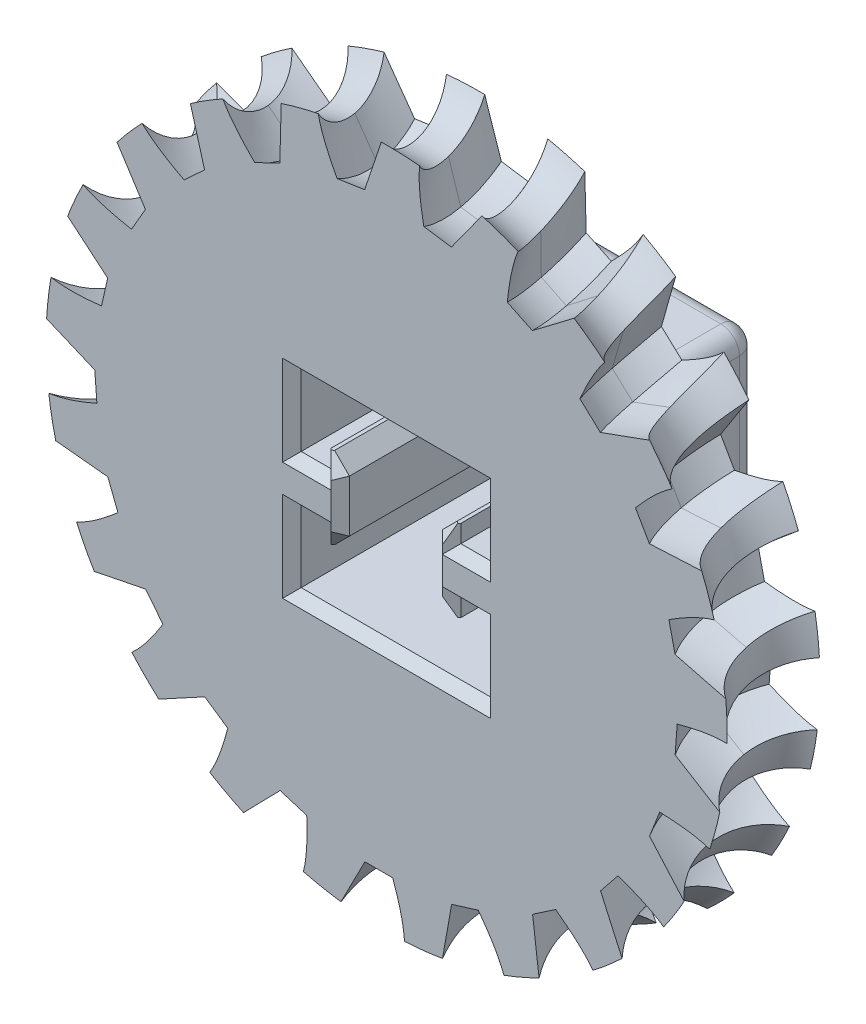
from build123d import *

# Parameters (mm, degrees)
SKETCH1_R              = 40
SKETCH1_R_2            = 4
BOSS_EXTRUDE1_DEPTH    = 10
CHAMFER1_SIZE          = 2
SKETCH2_R              = 6
CUT_SWEEP1_PITCH       = 10
CUT_SWEEP1_HEIGHT      = 2.5
CUT_SWEEP1_RADIUS      = 6
CUT_SWEEP1_START_ANGLE = -90
CUT_SWEEP2_PITCH       = 10
CUT_SWEEP2_HEIGHT      = 2.5
CUT_SWEEP2_RADIUS      = 6
CUT_SWEEP2_START_ANGLE = -90
CIRPATTERN1_COUNT      = 21
SKETCH14_W             = 30
SKETCH14_H             = 30
BOSS_EXTRUDE2_DEPTH    = 15
CUT_EXTRUDE4_DEPTH     = 25
CUT_EXTRUDE3_REACH     = 67.089
SKETCH15_R             = 2
FILLET1_R              = 2
CHAMFER2_SIZE          = 1


with BuildPart() as part:
    # Sketch1 → Boss-Extrude1 (new body)
    with BuildSketch(Plane.XY):
        Circle(SKETCH1_R)
        Circle(SKETCH1_R_2, mode=Mode.SUBTRACT)
    extrude(amount=BOSS_EXTRUDE1_DEPTH)

    # Chamfer1
    chamfer1_edges = [part.edges().sort_by_distance(p)[0] for p in [
        (-40, 0, 0),
        (-40, 0, 10),
    ]]
    chamfer(chamfer1_edges, length=CHAMFER1_SIZE)

    # Sketch2 → Cut-Revolve1 (revolve, cut)
    with BuildSketch(Plane(origin=(0, 0, 0), x_dir=(0, 0, -1), z_dir=(1, 0, 0)), mode=Mode.PRIVATE) as cut_revolve1_sk:
        with Locations((-5, -40)):
            Circle(SKETCH2_R)
    revolve(cut_revolve1_sk.sketch.rotate(Axis((0, 0, 0), (0, 0, -1)), 90), axis=Axis((0, 0, 0), (0, 0, -1)), mode=Mode.SUBTRACT)

    # Cut-Sweep1: sweep along a helix
    with BuildLine() as cut_sweep1_path:
        add(Helix(CUT_SWEEP1_PITCH, CUT_SWEEP1_HEIGHT, CUT_SWEEP1_RADIUS, center=(0, -40, 5), direction=(1, 0, 0), lefthand=True, mode=Mode.PRIVATE).rotate(Axis((0, -40, 5), (1, 0, 0)), CUT_SWEEP1_START_ANGLE))
    # Sketch5 → Cut-Sweep1 (sweep, cut)
    with BuildSketch(Plane.XY.offset(5)):
        Polygon((-1.5, -30), (1.5, -30), (3.5, -34), (3.5, -35.519818185), (-3.5, -35.519818185), (-3.5, -34), align=None)
    cut_sweep1 = sweep(path=cut_sweep1_path.line, is_frenet=True, mode=Mode.SUBTRACT)

    # Cut-Sweep2: sweep along a helix
    with BuildLine() as cut_sweep2_path:
        add(Helix(CUT_SWEEP2_PITCH, CUT_SWEEP2_HEIGHT, CUT_SWEEP2_RADIUS, center=(0, -40, 5), direction=(-1, 0, 0), lefthand=True, mode=Mode.PRIVATE).rotate(Axis((0, -40, 5), (-1, 0, 0)), CUT_SWEEP2_START_ANGLE))
    # Sketch7 → Cut-Sweep2 (sweep, cut)
    with BuildSketch(Plane.XY.offset(5)):
        Polygon((1.5, -30), (-1.5, -30), (-3.5, -34), (-3.5, -35.519818185), (3.5, -35.519818185), (3.5, -34), align=None)
    cut_sweep2 = sweep(path=cut_sweep2_path.line, is_frenet=True, mode=Mode.SUBTRACT)

    # CirPattern1: Cut-Sweep1, Cut-Sweep2 ×21 about axis
    cirpattern1_axis = Axis((0, 0, 10), (0, 0, -1))
    add([cut_sweep1.rotate(cirpattern1_axis, i * 360 / CIRPATTERN1_COUNT) for i in range(1, CIRPATTERN1_COUNT)], mode=Mode.SUBTRACT)
    add([cut_sweep2.rotate(cirpattern1_axis, i * 360 / CIRPATTERN1_COUNT) for i in range(1, CIRPATTERN1_COUNT)], mode=Mode.SUBTRACT)

    # Sketch14 → Boss-Extrude2 (add)
    with BuildSketch(Plane(origin=(0, 0, 0), x_dir=(-1, 0, 0), z_dir=(0, 0, -1))):
        Rectangle(SKETCH14_W, SKETCH14_H)
    extrude(amount=BOSS_EXTRUDE2_DEPTH)

    # Sketch13 → Cut-Extrude4 (cut)
    with BuildSketch(Plane.XY.offset(10)):
        Polygon((-3.1, 10.2), (3.1, 10.2), (10.2, 10.2), (10.2, 2.5), (7, 2.5), (7, 4.4), (6.6, 4.4), (5, 2.8), (5, -2.8), (6.6, -4.4), (7, -4.4), (7, -2.5), (10.2, -2.5), (10.2, -10.2), (3.1, -10.2), (-3.1, -10.2), (-10.2, -10.2), (-10.2, -2.5), (-7, -2.5), (-7, -4.4), (-6.6, -4.4), (-5, -2.8), (-5, 2.8), (-6.6, 4.4), (-7, 4.4), (-7, 2.5), (-10.2, 2.5), (-10.2, 10.2), align=None)
    extrude(amount=-CUT_EXTRUDE4_DEPTH, mode=Mode.SUBTRACT)

    # Cut-Extrude3: up to this face of the body (flat: up to its plane)
    cut_extrude3_end = Plane(part.part.faces().sort_by_distance((0, -15, -7.5))[0])
    # Sketch15 → Cut-Extrude3 (cut, up to the picked face)
    with BuildSketch(Plane(origin=(0, 15, 0), x_dir=(1, 0, 0), z_dir=(0, 1, 0)), mode=Mode.PRIVATE) as cut_extrude3_sk1:
        with Locations(Location((0, 7.5, 0), (0, 0, 270))):
            Circle(SKETCH15_R)
    cut_extrude3_tool1 = split(extrude(cut_extrude3_sk1.sketch, amount=-CUT_EXTRUDE3_REACH, mode=Mode.PRIVATE), bisect_by=cut_extrude3_end, keep=Keep.BOTH, mode=Mode.PRIVATE)
    add(cut_extrude3_tool1.solids().sort_by(Axis((0, 15, -7.5), (0, -1, 0)))[0], mode=Mode.SUBTRACT)

    # Fillet1
    fillet1_edges = [part.edges().sort_by_distance(p)[0] for p in [
        (0, -15, -9.5),
        (15, 0, -15),
        (15, 15, -7.5),
        (0, -15, 0),
        (15, -15, -7.5),
        (-15, 0, 0),
        (-15, -15, -7.5),
        (0, 15, -15),
        (-15, 15, -7.5),
        (0, -15, -15),
        (-15, 0, -15),
        (15, 0, 0),
        (0, 15, 0),
    ]]
    fillet(fillet1_edges, radius=FILLET1_R)

    # Chamfer2
    # the kernel refuses this chamfer: 1 mm, written as the material it takes off along each edge
    with BuildSketch(Plane(origin=(-10.2, 2.5, 10), x_dir=(-1, 0, 0), z_dir=(0, 1, 0)), Plane(origin=(-10.2, -10.2, 10), x_dir=(-1, 0, 0), z_dir=(0, 1, 0)), Plane(origin=(10.2, -2.5, 10), x_dir=(1, 0, 0), z_dir=(0, -1, 0)), Plane(origin=(10.2, 10.2, 10), x_dir=(1, 0, 0), z_dir=(0, -1, 0)), Plane(origin=(10.2, 10.2, -15), x_dir=(0, 0, 1), z_dir=(0, -1, 0)), Plane(origin=(10.2, -2.5, -15), x_dir=(0, 0, 1), z_dir=(0, -1, 0)), Plane(origin=(-10.2, -10.2, -15), x_dir=(0, 0, 1), z_dir=(0, 1, 0)), Plane(origin=(-10.2, 2.5, -15), x_dir=(0, 0, 1), z_dir=(0, 1, 0))) as chamfer2_piece_1:
        Polygon((CHAMFER2_SIZE, 0), (0, -CHAMFER2_SIZE), (0, 0), align=None)
    chamfer2_piece_1_solid = extrude(amount=7.7, mode=Mode.PRIVATE)
    with BuildSketch(Plane(origin=(-7, 2.5, 10), x_dir=(0, -1, 0), z_dir=(-1, 0, 0)), Plane(origin=(-10.2, -2.5, 10), x_dir=(0, 1, 0), z_dir=(1, 0, 0)), Plane(origin=(7, -2.5, 10), x_dir=(0, 1, 0), z_dir=(1, 0, 0)), Plane(origin=(10.2, 2.5, 10), x_dir=(0, -1, 0), z_dir=(-1, 0, 0)), Plane(origin=(10.2, 2.5, -15), x_dir=(0, 0, 1), z_dir=(-1, 0, 0)), Plane(origin=(7, -2.5, -15), x_dir=(0, 0, 1), z_dir=(1, 0, 0)), Plane(origin=(-10.2, -2.5, -15), x_dir=(0, 0, 1), z_dir=(1, 0, 0)), Plane(origin=(-7, 2.5, -15), x_dir=(0, 0, 1), z_dir=(-1, 0, 0))) as chamfer2_piece_2:
        Polygon((CHAMFER2_SIZE, 0), (0, -CHAMFER2_SIZE), (0, 0), align=None)
    chamfer2_piece_2_solid = extrude(amount=3.2, mode=Mode.PRIVATE)
    with BuildSketch(Plane(origin=(-7, 6.971682988, 10), x_dir=(1, 0, 0), z_dir=(0, -1, 0)), Plane(origin=(-7, -2.5, 10), x_dir=(1, 0, 0), z_dir=(0, -1, 0)), Plane(origin=(7, -6.971682988, 10), x_dir=(-1, 0, 0), z_dir=(0, 1, 0)), Plane(origin=(7, 2.5, 10), x_dir=(-1, 0, 0), z_dir=(0, 1, 0)), Plane(origin=(7, 2.5, -15), x_dir=(0, 0, 1), z_dir=(0, 1, 0)), Plane(origin=(7, -6.971682988, -15), x_dir=(0, 0, 1), z_dir=(0, 1, 0)), Plane(origin=(-7, -2.5, -15), x_dir=(0, 0, 1), z_dir=(0, -1, 0)), Plane(origin=(-7, 6.971682988, -15), x_dir=(0, 0, 1), z_dir=(0, -1, 0))) as chamfer2_piece_3:
        Polygon((CHAMFER2_SIZE, 0), (0, -CHAMFER2_SIZE), (0, 0), align=None)
    chamfer2_piece_3_solid = extrude(amount=4.471682988, mode=Mode.PRIVATE)
    with BuildSketch(Plane(origin=(-3.18154552, 0.98154552, 10), x_dir=(-0.7071067811865478, -0.7071067811865474, 0), z_dir=(-0.7071067811865474, 0.7071067811865478, 0)), Plane(origin=(-8.41845448, -6.21845448, 10), x_dir=(-0.7071067811865478, 0.7071067811865474, 0), z_dir=(0.7071067811865474, 0.7071067811865478, 0)), Plane(origin=(3.18154552, -0.98154552, 10), x_dir=(0.7071067811865478, 0.7071067811865474, 0), z_dir=(0.7071067811865474, -0.7071067811865478, 0)), Plane(origin=(8.41845448, 6.21845448, 10), x_dir=(0.7071067811865478, -0.7071067811865474, 0), z_dir=(-0.7071067811865474, -0.7071067811865478, 0)), Plane(origin=(8.41845448, 6.21845448, -15), x_dir=(0, 0, 1), z_dir=(-0.7071067811865474, -0.7071067811865478, 0)), Plane(origin=(3.18154552, -0.98154552, -15), x_dir=(0, 0, 1), z_dir=(0.7071067811865474, -0.7071067811865478, 0)), Plane(origin=(-8.41845448, -6.21845448, -15), x_dir=(0, 0, 1), z_dir=(0.7071067811865474, 0.7071067811865478, 0)), Plane(origin=(-3.18154552, 0.98154552, -15), x_dir=(0, 0, 1), z_dir=(-0.7071067811865474, 0.7071067811865478, 0))) as chamfer2_piece_4:
        Polygon((CHAMFER2_SIZE, 0), (0, -CHAMFER2_SIZE), (0, 0), align=None)
    chamfer2_piece_4_solid = extrude(amount=7.406107676, mode=Mode.PRIVATE)
    with BuildSketch(Plane(origin=(-5, -5.371682988, 10), x_dir=(-1, 0, 0), z_dir=(0, 1, 0)), Plane(origin=(5, 5.371682988, 10), x_dir=(1, 0, 0), z_dir=(0, -1, 0)), Plane(origin=(5, 5.371682988, -15), x_dir=(0, 0, 1), z_dir=(0, -1, 0)), Plane(origin=(-5, -5.371682988, -15), x_dir=(0, 0, 1), z_dir=(0, 1, 0))) as chamfer2_piece_5:
        Polygon((CHAMFER2_SIZE, 0), (0, -CHAMFER2_SIZE), (0, 0), align=None)
    chamfer2_piece_5_solid = extrude(amount=10.743365976, mode=Mode.PRIVATE)
    with BuildSketch(Plane(origin=(10.2, -10.2, 10), x_dir=(0, -1, 0), z_dir=(-1, 0, 0)), Plane(origin=(-10.2, 10.2, 10), x_dir=(0, 1, 0), z_dir=(1, 0, 0))) as chamfer2_piece_6:
        Polygon((CHAMFER2_SIZE, 0), (0, -CHAMFER2_SIZE), (0, 0), align=None)
    chamfer2_piece_6_solid = extrude(amount=20.4, mode=Mode.PRIVATE)
    with BuildSketch(Plane(origin=(-10.2, -10.2, -15), x_dir=(0, 0, 1), z_dir=(1, 0, 0)), Plane(origin=(10.2, 10.2, -15), x_dir=(0, 0, 1), z_dir=(-1, 0, 0))) as chamfer2_piece_7:
        Polygon((CHAMFER2_SIZE, 0), (0, CHAMFER2_SIZE), (0, 0), align=None)
    chamfer2_piece_7_solid = extrude(amount=20.4, mode=Mode.PRIVATE)
    with BuildSketch(Plane(origin=(0, 15, -7.5), x_dir=(0, 0, 1), z_dir=(-1, 0, 0))) as chamfer2_piece_8:
        Polygon((2 + CHAMFER2_SIZE, 0), (2, -CHAMFER2_SIZE), (2, 0), align=None)
    chamfer2_piece_8_solid = revolve(axis=Axis((0, 15, -7.5), (0, 1, 0)), mode=Mode.PRIVATE)
    with BuildSketch(Plane(origin=(-10.2, -0.071682988, 10), x_dir=(-1, 0, 0), z_dir=(0, 1, 0))) as chamfer2_piece_9a_section:
        Polygon((CHAMFER2_SIZE, 0), (0, -CHAMFER2_SIZE), (0, 0), align=None)
    chamfer2_piece_9a = extrude(amount=10.271682988, mode=Mode.PRIVATE)
    chamfer2_piece_9a = split(chamfer2_piece_9a, bisect_by=Plane(origin=(-10.2, 2.5, 10), z_dir=(0, -1, 0)), keep=Keep.TOP, mode=Mode.PRIVATE)
    with BuildSketch(Plane(origin=(-7, 2.5, 10), x_dir=(0, -1, 0), z_dir=(-1, 0, 0))) as chamfer2_piece_9b_section:
        Polygon((CHAMFER2_SIZE, 0), (0, -CHAMFER2_SIZE), (0, 0), align=None)
    chamfer2_piece_9b = extrude(amount=5.771682988, mode=Mode.PRIVATE)
    chamfer2_piece_9b = split(chamfer2_piece_9b, bisect_by=Plane(origin=(-10.2, 2.5, 10), z_dir=(-1, 0, 0)), keep=Keep.TOP, mode=Mode.PRIVATE)
    chamfer2_piece_9 = chamfer2_piece_9a & chamfer2_piece_9b
    with BuildSketch(Plane(origin=(-10.2, 2.5, 10), x_dir=(-1, 0, 0), z_dir=(0, 1, 0))) as chamfer2_piece_10a_section:
        Polygon((CHAMFER2_SIZE, 0), (0, -CHAMFER2_SIZE), (0, 0), align=None)
    chamfer2_piece_10a = extrude(amount=10.271682988, mode=Mode.PRIVATE)
    chamfer2_piece_10a = split(chamfer2_piece_10a, bisect_by=Plane(origin=(-10.2, 10.2, 10), z_dir=(0, 1, 0)), keep=Keep.TOP, mode=Mode.PRIVATE)
    with BuildSketch(Plane(origin=(-12.771682988, 10.2, 10), x_dir=(0, 1, 0), z_dir=(1, 0, 0))) as chamfer2_piece_10b_section:
        Polygon((CHAMFER2_SIZE, 0), (0, -CHAMFER2_SIZE), (0, 0), align=None)
    chamfer2_piece_10b = extrude(amount=22.971682988, mode=Mode.PRIVATE)
    chamfer2_piece_10b = split(chamfer2_piece_10b, bisect_by=Plane(origin=(-10.2, 10.2, 10), z_dir=(-1, 0, 0)), keep=Keep.TOP, mode=Mode.PRIVATE)
    chamfer2_piece_10 = chamfer2_piece_10a & chamfer2_piece_10b
    with BuildSketch(Plane(origin=(-4.428317012, 2.5, 10), x_dir=(0, -1, 0), z_dir=(-1, 0, 0))) as chamfer2_piece_11a_section:
        Polygon((CHAMFER2_SIZE, 0), (0, -CHAMFER2_SIZE), (0, 0), align=None)
    chamfer2_piece_11a = extrude(amount=5.771682988, mode=Mode.PRIVATE)
    chamfer2_piece_11a = split(chamfer2_piece_11a, bisect_by=Plane(origin=(-7, 2.5, 10), z_dir=(1, 0, 0)), keep=Keep.TOP, mode=Mode.PRIVATE)
    with BuildSketch(Plane(origin=(-7, 6.971682988, 10), x_dir=(1, 0, 0), z_dir=(0, -1, 0))) as chamfer2_piece_11b_section:
        Polygon((CHAMFER2_SIZE, 0), (0, -CHAMFER2_SIZE), (0, 0), align=None)
    chamfer2_piece_11b = extrude(amount=7.043365976, mode=Mode.PRIVATE)
    chamfer2_piece_11b = split(chamfer2_piece_11b, bisect_by=Plane(origin=(-7, 2.5, 10), z_dir=(0, -1, 0)), keep=Keep.TOP, mode=Mode.PRIVATE)
    chamfer2_piece_11 = chamfer2_piece_11a & chamfer2_piece_11b
    with BuildSketch(Plane(origin=(-7, 0.071682988, 10), x_dir=(1, 0, 0), z_dir=(0, -1, 0))) as chamfer2_piece_12a_section:
        Polygon((CHAMFER2_SIZE, 0), (0, -CHAMFER2_SIZE), (0, 0), align=None)
    chamfer2_piece_12a = extrude(amount=7.043365976, mode=Mode.PRIVATE)
    chamfer2_piece_12a = split(chamfer2_piece_12a, bisect_by=Plane(origin=(-7, -2.5, 10), z_dir=(0, 1, 0)), keep=Keep.TOP, mode=Mode.PRIVATE)
    with BuildSketch(Plane(origin=(-10.2, -2.5, 10), x_dir=(0, 1, 0), z_dir=(1, 0, 0))) as chamfer2_piece_12b_section:
        Polygon((CHAMFER2_SIZE, 0), (0, -CHAMFER2_SIZE), (0, 0), align=None)
    chamfer2_piece_12b = extrude(amount=5.771682988, mode=Mode.PRIVATE)
    chamfer2_piece_12b = split(chamfer2_piece_12b, bisect_by=Plane(origin=(-7, -2.5, 10), z_dir=(1, 0, 0)), keep=Keep.TOP, mode=Mode.PRIVATE)
    chamfer2_piece_12 = chamfer2_piece_12a & chamfer2_piece_12b
    with BuildSketch(Plane(origin=(-12.771682988, -2.5, 10), x_dir=(0, 1, 0), z_dir=(1, 0, 0))) as chamfer2_piece_13a_section:
        Polygon((CHAMFER2_SIZE, 0), (0, -CHAMFER2_SIZE), (0, 0), align=None)
    chamfer2_piece_13a = extrude(amount=5.771682988, mode=Mode.PRIVATE)
    chamfer2_piece_13a = split(chamfer2_piece_13a, bisect_by=Plane(origin=(-10.2, -2.5, 10), z_dir=(-1, 0, 0)), keep=Keep.TOP, mode=Mode.PRIVATE)
    with BuildSketch(Plane(origin=(-10.2, -10.2, 10), x_dir=(-1, 0, 0), z_dir=(0, 1, 0))) as chamfer2_piece_13b_section:
        Polygon((CHAMFER2_SIZE, 0), (0, -CHAMFER2_SIZE), (0, 0), align=None)
    chamfer2_piece_13b = extrude(amount=10.271682988, mode=Mode.PRIVATE)
    chamfer2_piece_13b = split(chamfer2_piece_13b, bisect_by=Plane(origin=(-10.2, -2.5, 10), z_dir=(0, 1, 0)), keep=Keep.TOP, mode=Mode.PRIVATE)
    chamfer2_piece_13 = chamfer2_piece_13a & chamfer2_piece_13b
    with BuildSketch(Plane(origin=(-10.2, -12.771682988, 10), x_dir=(-1, 0, 0), z_dir=(0, 1, 0))) as chamfer2_piece_14a_section:
        Polygon((CHAMFER2_SIZE, 0), (0, -CHAMFER2_SIZE), (0, 0), align=None)
    chamfer2_piece_14a = extrude(amount=10.271682988, mode=Mode.PRIVATE)
    chamfer2_piece_14a = split(chamfer2_piece_14a, bisect_by=Plane(origin=(-10.2, -10.2, 10), z_dir=(0, -1, 0)), keep=Keep.TOP, mode=Mode.PRIVATE)
    with BuildSketch(Plane(origin=(10.2, -10.2, 10), x_dir=(0, -1, 0), z_dir=(-1, 0, 0))) as chamfer2_piece_14b_section:
        Polygon((CHAMFER2_SIZE, 0), (0, -CHAMFER2_SIZE), (0, 0), align=None)
    chamfer2_piece_14b = extrude(amount=22.971682988, mode=Mode.PRIVATE)
    chamfer2_piece_14b = split(chamfer2_piece_14b, bisect_by=Plane(origin=(-10.2, -10.2, 10), z_dir=(-1, 0, 0)), keep=Keep.TOP, mode=Mode.PRIVATE)
    chamfer2_piece_14 = chamfer2_piece_14a & chamfer2_piece_14b
    with BuildSketch(Plane(origin=(12.771682988, -10.2, 10), x_dir=(0, -1, 0), z_dir=(-1, 0, 0))) as chamfer2_piece_15a_section:
        Polygon((CHAMFER2_SIZE, 0), (0, -CHAMFER2_SIZE), (0, 0), align=None)
    chamfer2_piece_15a = extrude(amount=22.971682988, mode=Mode.PRIVATE)
    chamfer2_piece_15a = split(chamfer2_piece_15a, bisect_by=Plane(origin=(10.2, -10.2, 10), z_dir=(1, 0, 0)), keep=Keep.TOP, mode=Mode.PRIVATE)
    with BuildSketch(Plane(origin=(10.2, -2.5, 10), x_dir=(1, 0, 0), z_dir=(0, -1, 0))) as chamfer2_piece_15b_section:
        Polygon((CHAMFER2_SIZE, 0), (0, -CHAMFER2_SIZE), (0, 0), align=None)
    chamfer2_piece_15b = extrude(amount=10.271682988, mode=Mode.PRIVATE)
    chamfer2_piece_15b = split(chamfer2_piece_15b, bisect_by=Plane(origin=(10.2, -10.2, 10), z_dir=(0, -1, 0)), keep=Keep.TOP, mode=Mode.PRIVATE)
    chamfer2_piece_15 = chamfer2_piece_15a & chamfer2_piece_15b
    with BuildSketch(Plane(origin=(10.2, 0.071682988, 10), x_dir=(1, 0, 0), z_dir=(0, -1, 0))) as chamfer2_piece_16a_section:
        Polygon((CHAMFER2_SIZE, 0), (0, -CHAMFER2_SIZE), (0, 0), align=None)
    chamfer2_piece_16a = extrude(amount=10.271682988, mode=Mode.PRIVATE)
    chamfer2_piece_16a = split(chamfer2_piece_16a, bisect_by=Plane(origin=(10.2, -2.5, 10), z_dir=(0, 1, 0)), keep=Keep.TOP, mode=Mode.PRIVATE)
    with BuildSketch(Plane(origin=(7, -2.5, 10), x_dir=(0, 1, 0), z_dir=(1, 0, 0))) as chamfer2_piece_16b_section:
        Polygon((CHAMFER2_SIZE, 0), (0, -CHAMFER2_SIZE), (0, 0), align=None)
    chamfer2_piece_16b = extrude(amount=5.771682988, mode=Mode.PRIVATE)
    chamfer2_piece_16b = split(chamfer2_piece_16b, bisect_by=Plane(origin=(10.2, -2.5, 10), z_dir=(1, 0, 0)), keep=Keep.TOP, mode=Mode.PRIVATE)
    chamfer2_piece_16 = chamfer2_piece_16a & chamfer2_piece_16b
    with BuildSketch(Plane(origin=(4.428317012, -2.5, 10), x_dir=(0, 1, 0), z_dir=(1, 0, 0))) as chamfer2_piece_17a_section:
        Polygon((CHAMFER2_SIZE, 0), (0, -CHAMFER2_SIZE), (0, 0), align=None)
    chamfer2_piece_17a = extrude(amount=5.771682988, mode=Mode.PRIVATE)
    chamfer2_piece_17a = split(chamfer2_piece_17a, bisect_by=Plane(origin=(7, -2.5, 10), z_dir=(-1, 0, 0)), keep=Keep.TOP, mode=Mode.PRIVATE)
    with BuildSketch(Plane(origin=(7, -6.971682988, 10), x_dir=(-1, 0, 0), z_dir=(0, 1, 0))) as chamfer2_piece_17b_section:
        Polygon((CHAMFER2_SIZE, 0), (0, -CHAMFER2_SIZE), (0, 0), align=None)
    chamfer2_piece_17b = extrude(amount=7.043365976, mode=Mode.PRIVATE)
    chamfer2_piece_17b = split(chamfer2_piece_17b, bisect_by=Plane(origin=(7, -2.5, 10), z_dir=(0, 1, 0)), keep=Keep.TOP, mode=Mode.PRIVATE)
    chamfer2_piece_17 = chamfer2_piece_17a & chamfer2_piece_17b
    with BuildSketch(Plane(origin=(7, -0.071682988, 10), x_dir=(-1, 0, 0), z_dir=(0, 1, 0))) as chamfer2_piece_18a_section:
        Polygon((CHAMFER2_SIZE, 0), (0, -CHAMFER2_SIZE), (0, 0), align=None)
    chamfer2_piece_18a = extrude(amount=7.043365976, mode=Mode.PRIVATE)
    chamfer2_piece_18a = split(chamfer2_piece_18a, bisect_by=Plane(origin=(7, 2.5, 10), z_dir=(0, -1, 0)), keep=Keep.TOP, mode=Mode.PRIVATE)
    with BuildSketch(Plane(origin=(10.2, 2.5, 10), x_dir=(0, -1, 0), z_dir=(-1, 0, 0))) as chamfer2_piece_18b_section:
        Polygon((CHAMFER2_SIZE, 0), (0, -CHAMFER2_SIZE), (0, 0), align=None)
    chamfer2_piece_18b = extrude(amount=5.771682988, mode=Mode.PRIVATE)
    chamfer2_piece_18b = split(chamfer2_piece_18b, bisect_by=Plane(origin=(7, 2.5, 10), z_dir=(-1, 0, 0)), keep=Keep.TOP, mode=Mode.PRIVATE)
    chamfer2_piece_18 = chamfer2_piece_18a & chamfer2_piece_18b
    with BuildSketch(Plane(origin=(12.771682988, 2.5, 10), x_dir=(0, -1, 0), z_dir=(-1, 0, 0))) as chamfer2_piece_19a_section:
        Polygon((CHAMFER2_SIZE, 0), (0, -CHAMFER2_SIZE), (0, 0), align=None)
    chamfer2_piece_19a = extrude(amount=5.771682988, mode=Mode.PRIVATE)
    chamfer2_piece_19a = split(chamfer2_piece_19a, bisect_by=Plane(origin=(10.2, 2.5, 10), z_dir=(1, 0, 0)), keep=Keep.TOP, mode=Mode.PRIVATE)
    with BuildSketch(Plane(origin=(10.2, 10.2, 10), x_dir=(1, 0, 0), z_dir=(0, -1, 0))) as chamfer2_piece_19b_section:
        Polygon((CHAMFER2_SIZE, 0), (0, -CHAMFER2_SIZE), (0, 0), align=None)
    chamfer2_piece_19b = extrude(amount=10.271682988, mode=Mode.PRIVATE)
    chamfer2_piece_19b = split(chamfer2_piece_19b, bisect_by=Plane(origin=(10.2, 2.5, 10), z_dir=(0, -1, 0)), keep=Keep.TOP, mode=Mode.PRIVATE)
    chamfer2_piece_19 = chamfer2_piece_19a & chamfer2_piece_19b
    with BuildSketch(Plane(origin=(10.2, 12.771682988, 10), x_dir=(1, 0, 0), z_dir=(0, -1, 0))) as chamfer2_piece_20a_section:
        Polygon((CHAMFER2_SIZE, 0), (0, -CHAMFER2_SIZE), (0, 0), align=None)
    chamfer2_piece_20a = extrude(amount=10.271682988, mode=Mode.PRIVATE)
    chamfer2_piece_20a = split(chamfer2_piece_20a, bisect_by=Plane(origin=(10.2, 10.2, 10), z_dir=(0, 1, 0)), keep=Keep.TOP, mode=Mode.PRIVATE)
    with BuildSketch(Plane(origin=(-10.2, 10.2, 10), x_dir=(0, 1, 0), z_dir=(1, 0, 0))) as chamfer2_piece_20b_section:
        Polygon((CHAMFER2_SIZE, 0), (0, -CHAMFER2_SIZE), (0, 0), align=None)
    chamfer2_piece_20b = extrude(amount=22.971682988, mode=Mode.PRIVATE)
    chamfer2_piece_20b = split(chamfer2_piece_20b, bisect_by=Plane(origin=(10.2, 10.2, 10), z_dir=(1, 0, 0)), keep=Keep.TOP, mode=Mode.PRIVATE)
    chamfer2_piece_20 = chamfer2_piece_20a & chamfer2_piece_20b
    with BuildSketch(Plane(origin=(10.2, 12.771682988, -15), x_dir=(0, 0, 1), z_dir=(0, -1, 0))) as chamfer2_piece_21a_section:
        Polygon((CHAMFER2_SIZE, 0), (0, -CHAMFER2_SIZE), (0, 0), align=None)
    chamfer2_piece_21a = extrude(amount=10.271682988, mode=Mode.PRIVATE)
    chamfer2_piece_21a = split(chamfer2_piece_21a, bisect_by=Plane(origin=(10.2, 10.2, -15), z_dir=(0, 1, 0)), keep=Keep.TOP, mode=Mode.PRIVATE)
    with BuildSketch(Plane(origin=(12.771682988, 10.2, -15), x_dir=(0, 0, 1), z_dir=(-1, 0, 0))) as chamfer2_piece_21b_section:
        Polygon((CHAMFER2_SIZE, 0), (0, CHAMFER2_SIZE), (0, 0), align=None)
    chamfer2_piece_21b = extrude(amount=22.971682988, mode=Mode.PRIVATE)
    chamfer2_piece_21b = split(chamfer2_piece_21b, bisect_by=Plane(origin=(10.2, 10.2, -15), z_dir=(1, 0, 0)), keep=Keep.TOP, mode=Mode.PRIVATE)
    chamfer2_piece_21 = chamfer2_piece_21a & chamfer2_piece_21b
    with BuildSketch(Plane(origin=(12.771682988, 2.5, -15), x_dir=(0, 0, 1), z_dir=(-1, 0, 0))) as chamfer2_piece_22a_section:
        Polygon((CHAMFER2_SIZE, 0), (0, -CHAMFER2_SIZE), (0, 0), align=None)
    chamfer2_piece_22a = extrude(amount=5.771682988, mode=Mode.PRIVATE)
    chamfer2_piece_22a = split(chamfer2_piece_22a, bisect_by=Plane(origin=(10.2, 2.5, -15), z_dir=(1, 0, 0)), keep=Keep.TOP, mode=Mode.PRIVATE)
    with BuildSketch(Plane(origin=(10.2, 10.2, -15), x_dir=(0, 0, 1), z_dir=(0, -1, 0))) as chamfer2_piece_22b_section:
        Polygon((CHAMFER2_SIZE, 0), (0, -CHAMFER2_SIZE), (0, 0), align=None)
    chamfer2_piece_22b = extrude(amount=10.271682988, mode=Mode.PRIVATE)
    chamfer2_piece_22b = split(chamfer2_piece_22b, bisect_by=Plane(origin=(10.2, 2.5, -15), z_dir=(0, -1, 0)), keep=Keep.TOP, mode=Mode.PRIVATE)
    chamfer2_piece_22 = chamfer2_piece_22a & chamfer2_piece_22b
    with BuildSketch(Plane(origin=(7, -0.071682988, -15), x_dir=(0, 0, 1), z_dir=(0, 1, 0))) as chamfer2_piece_23a_section:
        Polygon((CHAMFER2_SIZE, 0), (0, -CHAMFER2_SIZE), (0, 0), align=None)
    chamfer2_piece_23a = extrude(amount=7.043365976, mode=Mode.PRIVATE)
    chamfer2_piece_23a = split(chamfer2_piece_23a, bisect_by=Plane(origin=(7, 2.5, -15), z_dir=(0, -1, 0)), keep=Keep.TOP, mode=Mode.PRIVATE)
    with BuildSketch(Plane(origin=(10.2, 2.5, -15), x_dir=(0, 0, 1), z_dir=(-1, 0, 0))) as chamfer2_piece_23b_section:
        Polygon((CHAMFER2_SIZE, 0), (0, -CHAMFER2_SIZE), (0, 0), align=None)
    chamfer2_piece_23b = extrude(amount=5.771682988, mode=Mode.PRIVATE)
    chamfer2_piece_23b = split(chamfer2_piece_23b, bisect_by=Plane(origin=(7, 2.5, -15), z_dir=(-1, 0, 0)), keep=Keep.TOP, mode=Mode.PRIVATE)
    chamfer2_piece_23 = chamfer2_piece_23a & chamfer2_piece_23b
    with BuildSketch(Plane(origin=(4.428317012, -2.5, -15), x_dir=(0, 0, 1), z_dir=(1, 0, 0))) as chamfer2_piece_24a_section:
        Polygon((CHAMFER2_SIZE, 0), (0, -CHAMFER2_SIZE), (0, 0), align=None)
    chamfer2_piece_24a = extrude(amount=5.771682988, mode=Mode.PRIVATE)
    chamfer2_piece_24a = split(chamfer2_piece_24a, bisect_by=Plane(origin=(7, -2.5, -15), z_dir=(-1, 0, 0)), keep=Keep.TOP, mode=Mode.PRIVATE)
    with BuildSketch(Plane(origin=(7, -6.971682988, -15), x_dir=(0, 0, 1), z_dir=(0, 1, 0))) as chamfer2_piece_24b_section:
        Polygon((CHAMFER2_SIZE, 0), (0, -CHAMFER2_SIZE), (0, 0), align=None)
    chamfer2_piece_24b = extrude(amount=7.043365976, mode=Mode.PRIVATE)
    chamfer2_piece_24b = split(chamfer2_piece_24b, bisect_by=Plane(origin=(7, -2.5, -15), z_dir=(0, 1, 0)), keep=Keep.TOP, mode=Mode.PRIVATE)
    chamfer2_piece_24 = chamfer2_piece_24a & chamfer2_piece_24b
    with BuildSketch(Plane(origin=(10.2, 0.071682988, -15), x_dir=(0, 0, 1), z_dir=(0, -1, 0))) as chamfer2_piece_25a_section:
        Polygon((CHAMFER2_SIZE, 0), (0, -CHAMFER2_SIZE), (0, 0), align=None)
    chamfer2_piece_25a = extrude(amount=10.271682988, mode=Mode.PRIVATE)
    chamfer2_piece_25a = split(chamfer2_piece_25a, bisect_by=Plane(origin=(10.2, -2.5, -15), z_dir=(0, 1, 0)), keep=Keep.TOP, mode=Mode.PRIVATE)
    with BuildSketch(Plane(origin=(7, -2.5, -15), x_dir=(0, 0, 1), z_dir=(1, 0, 0))) as chamfer2_piece_25b_section:
        Polygon((CHAMFER2_SIZE, 0), (0, -CHAMFER2_SIZE), (0, 0), align=None)
    chamfer2_piece_25b = extrude(amount=5.771682988, mode=Mode.PRIVATE)
    chamfer2_piece_25b = split(chamfer2_piece_25b, bisect_by=Plane(origin=(10.2, -2.5, -15), z_dir=(1, 0, 0)), keep=Keep.TOP, mode=Mode.PRIVATE)
    chamfer2_piece_25 = chamfer2_piece_25a & chamfer2_piece_25b
    with BuildSketch(Plane(origin=(-10.2, -10.2, -15), x_dir=(0, 0, 1), z_dir=(1, 0, 0))) as chamfer2_piece_26a_section:
        Polygon((CHAMFER2_SIZE, 0), (0, CHAMFER2_SIZE), (0, 0), align=None)
    chamfer2_piece_26a = extrude(amount=22.971682988, mode=Mode.PRIVATE)
    chamfer2_piece_26a = split(chamfer2_piece_26a, bisect_by=Plane(origin=(10.2, -10.2, -15), z_dir=(1, 0, 0)), keep=Keep.TOP, mode=Mode.PRIVATE)
    with BuildSketch(Plane(origin=(10.2, -2.5, -15), x_dir=(0, 0, 1), z_dir=(0, -1, 0))) as chamfer2_piece_26b_section:
        Polygon((CHAMFER2_SIZE, 0), (0, -CHAMFER2_SIZE), (0, 0), align=None)
    chamfer2_piece_26b = extrude(amount=10.271682988, mode=Mode.PRIVATE)
    chamfer2_piece_26b = split(chamfer2_piece_26b, bisect_by=Plane(origin=(10.2, -10.2, -15), z_dir=(0, -1, 0)), keep=Keep.TOP, mode=Mode.PRIVATE)
    chamfer2_piece_26 = chamfer2_piece_26a & chamfer2_piece_26b
    with BuildSketch(Plane(origin=(-10.2, -12.771682988, -15), x_dir=(0, 0, 1), z_dir=(0, 1, 0))) as chamfer2_piece_27a_section:
        Polygon((CHAMFER2_SIZE, 0), (0, -CHAMFER2_SIZE), (0, 0), align=None)
    chamfer2_piece_27a = extrude(amount=10.271682988, mode=Mode.PRIVATE)
    chamfer2_piece_27a = split(chamfer2_piece_27a, bisect_by=Plane(origin=(-10.2, -10.2, -15), z_dir=(0, -1, 0)), keep=Keep.TOP, mode=Mode.PRIVATE)
    with BuildSketch(Plane(origin=(-12.771682988, -10.2, -15), x_dir=(0, 0, 1), z_dir=(1, 0, 0))) as chamfer2_piece_27b_section:
        Polygon((CHAMFER2_SIZE, 0), (0, CHAMFER2_SIZE), (0, 0), align=None)
    chamfer2_piece_27b = extrude(amount=22.971682988, mode=Mode.PRIVATE)
    chamfer2_piece_27b = split(chamfer2_piece_27b, bisect_by=Plane(origin=(-10.2, -10.2, -15), z_dir=(-1, 0, 0)), keep=Keep.TOP, mode=Mode.PRIVATE)
    chamfer2_piece_27 = chamfer2_piece_27a & chamfer2_piece_27b
    with BuildSketch(Plane(origin=(-12.771682988, -2.5, -15), x_dir=(0, 0, 1), z_dir=(1, 0, 0))) as chamfer2_piece_28a_section:
        Polygon((CHAMFER2_SIZE, 0), (0, -CHAMFER2_SIZE), (0, 0), align=None)
    chamfer2_piece_28a = extrude(amount=5.771682988, mode=Mode.PRIVATE)
    chamfer2_piece_28a = split(chamfer2_piece_28a, bisect_by=Plane(origin=(-10.2, -2.5, -15), z_dir=(-1, 0, 0)), keep=Keep.TOP, mode=Mode.PRIVATE)
    with BuildSketch(Plane(origin=(-10.2, -10.2, -15), x_dir=(0, 0, 1), z_dir=(0, 1, 0))) as chamfer2_piece_28b_section:
        Polygon((CHAMFER2_SIZE, 0), (0, -CHAMFER2_SIZE), (0, 0), align=None)
    chamfer2_piece_28b = extrude(amount=10.271682988, mode=Mode.PRIVATE)
    chamfer2_piece_28b = split(chamfer2_piece_28b, bisect_by=Plane(origin=(-10.2, -2.5, -15), z_dir=(0, 1, 0)), keep=Keep.TOP, mode=Mode.PRIVATE)
    chamfer2_piece_28 = chamfer2_piece_28a & chamfer2_piece_28b
    with BuildSketch(Plane(origin=(-7, 0.071682988, -15), x_dir=(0, 0, 1), z_dir=(0, -1, 0))) as chamfer2_piece_29a_section:
        Polygon((CHAMFER2_SIZE, 0), (0, -CHAMFER2_SIZE), (0, 0), align=None)
    chamfer2_piece_29a = extrude(amount=7.043365976, mode=Mode.PRIVATE)
    chamfer2_piece_29a = split(chamfer2_piece_29a, bisect_by=Plane(origin=(-7, -2.5, -15), z_dir=(0, 1, 0)), keep=Keep.TOP, mode=Mode.PRIVATE)
    with BuildSketch(Plane(origin=(-10.2, -2.5, -15), x_dir=(0, 0, 1), z_dir=(1, 0, 0))) as chamfer2_piece_29b_section:
        Polygon((CHAMFER2_SIZE, 0), (0, -CHAMFER2_SIZE), (0, 0), align=None)
    chamfer2_piece_29b = extrude(amount=5.771682988, mode=Mode.PRIVATE)
    chamfer2_piece_29b = split(chamfer2_piece_29b, bisect_by=Plane(origin=(-7, -2.5, -15), z_dir=(1, 0, 0)), keep=Keep.TOP, mode=Mode.PRIVATE)
    chamfer2_piece_29 = chamfer2_piece_29a & chamfer2_piece_29b
    with BuildSketch(Plane(origin=(-4.428317012, 2.5, -15), x_dir=(0, 0, 1), z_dir=(-1, 0, 0))) as chamfer2_piece_30a_section:
        Polygon((CHAMFER2_SIZE, 0), (0, -CHAMFER2_SIZE), (0, 0), align=None)
    chamfer2_piece_30a = extrude(amount=5.771682988, mode=Mode.PRIVATE)
    chamfer2_piece_30a = split(chamfer2_piece_30a, bisect_by=Plane(origin=(-7, 2.5, -15), z_dir=(1, 0, 0)), keep=Keep.TOP, mode=Mode.PRIVATE)
    with BuildSketch(Plane(origin=(-7, 6.971682988, -15), x_dir=(0, 0, 1), z_dir=(0, -1, 0))) as chamfer2_piece_30b_section:
        Polygon((CHAMFER2_SIZE, 0), (0, -CHAMFER2_SIZE), (0, 0), align=None)
    chamfer2_piece_30b = extrude(amount=7.043365976, mode=Mode.PRIVATE)
    chamfer2_piece_30b = split(chamfer2_piece_30b, bisect_by=Plane(origin=(-7, 2.5, -15), z_dir=(0, -1, 0)), keep=Keep.TOP, mode=Mode.PRIVATE)
    chamfer2_piece_30 = chamfer2_piece_30a & chamfer2_piece_30b
    with BuildSketch(Plane(origin=(-10.2, -0.071682988, -15), x_dir=(0, 0, 1), z_dir=(0, 1, 0))) as chamfer2_piece_31a_section:
        Polygon((CHAMFER2_SIZE, 0), (0, -CHAMFER2_SIZE), (0, 0), align=None)
    chamfer2_piece_31a = extrude(amount=10.271682988, mode=Mode.PRIVATE)
    chamfer2_piece_31a = split(chamfer2_piece_31a, bisect_by=Plane(origin=(-10.2, 2.5, -15), z_dir=(0, -1, 0)), keep=Keep.TOP, mode=Mode.PRIVATE)
    with BuildSketch(Plane(origin=(-7, 2.5, -15), x_dir=(0, 0, 1), z_dir=(-1, 0, 0))) as chamfer2_piece_31b_section:
        Polygon((CHAMFER2_SIZE, 0), (0, -CHAMFER2_SIZE), (0, 0), align=None)
    chamfer2_piece_31b = extrude(amount=5.771682988, mode=Mode.PRIVATE)
    chamfer2_piece_31b = split(chamfer2_piece_31b, bisect_by=Plane(origin=(-10.2, 2.5, -15), z_dir=(-1, 0, 0)), keep=Keep.TOP, mode=Mode.PRIVATE)
    chamfer2_piece_31 = chamfer2_piece_31a & chamfer2_piece_31b
    with BuildSketch(Plane(origin=(-10.2, 2.5, -15), x_dir=(0, 0, 1), z_dir=(0, 1, 0))) as chamfer2_piece_32a_section:
        Polygon((CHAMFER2_SIZE, 0), (0, -CHAMFER2_SIZE), (0, 0), align=None)
    chamfer2_piece_32a = extrude(amount=10.271682988, mode=Mode.PRIVATE)
    chamfer2_piece_32a = split(chamfer2_piece_32a, bisect_by=Plane(origin=(-10.2, 10.2, -15), z_dir=(0, 1, 0)), keep=Keep.TOP, mode=Mode.PRIVATE)
    with BuildSketch(Plane(origin=(10.2, 10.2, -15), x_dir=(0, 0, 1), z_dir=(-1, 0, 0))) as chamfer2_piece_32b_section:
        Polygon((CHAMFER2_SIZE, 0), (0, CHAMFER2_SIZE), (0, 0), align=None)
    chamfer2_piece_32b = extrude(amount=22.971682988, mode=Mode.PRIVATE)
    chamfer2_piece_32b = split(chamfer2_piece_32b, bisect_by=Plane(origin=(-10.2, 10.2, -15), z_dir=(-1, 0, 0)), keep=Keep.TOP, mode=Mode.PRIVATE)
    chamfer2_piece_32 = chamfer2_piece_32a & chamfer2_piece_32b
    add([chamfer2_piece_1_solid, chamfer2_piece_2_solid, chamfer2_piece_3_solid, chamfer2_piece_4_solid, chamfer2_piece_5_solid, chamfer2_piece_6_solid, chamfer2_piece_7_solid, chamfer2_piece_8_solid, chamfer2_piece_9, chamfer2_piece_10, chamfer2_piece_11, chamfer2_piece_12, chamfer2_piece_13, chamfer2_piece_14, chamfer2_piece_15, chamfer2_piece_16, chamfer2_piece_17, chamfer2_piece_18, chamfer2_piece_19, chamfer2_piece_20, chamfer2_piece_21, chamfer2_piece_22, chamfer2_piece_23, chamfer2_piece_24, chamfer2_piece_25, chamfer2_piece_26, chamfer2_piece_27, chamfer2_piece_28, chamfer2_piece_29, chamfer2_piece_30, chamfer2_piece_31, chamfer2_piece_32], mode=Mode.SUBTRACT)


solid = part.part
